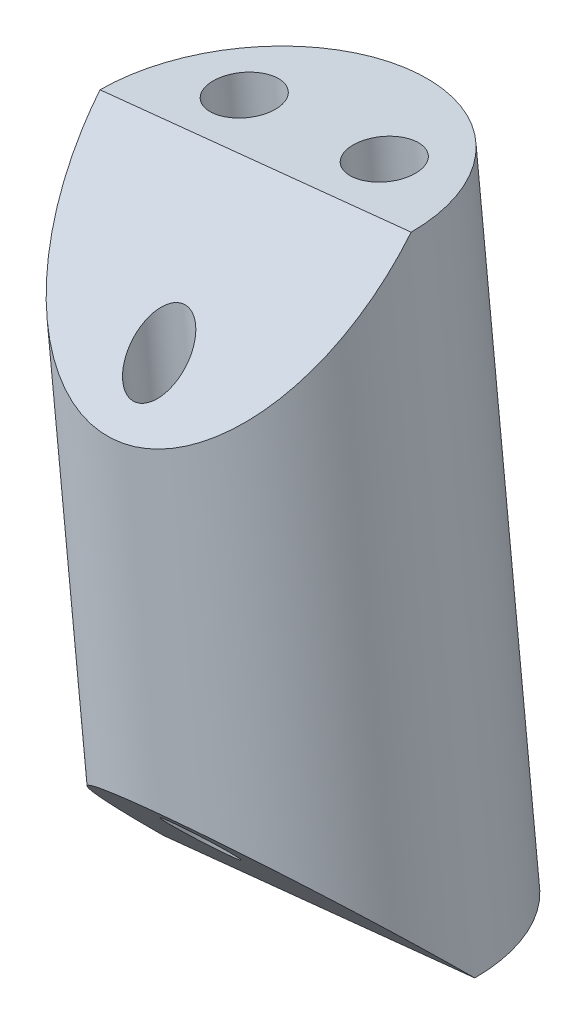
from build123d import *

# Parameters (mm, degrees)
SKETCH3_R               = 8
BOSS_EXTRUDE1_DEPTH     = 31.578947368
CUT_EXTRUDE1_DEPTH      = 200.187264303
CUT_EXTRUDE1_DEPTH_BACK = 200.187264303
CUT_EXTRUDE3_DEPTH      = 39.743711945
CUT_EXTRUDE3_DEPTH_BACK = 39.743711945
SKETCH8_R               = 1.4
SKETCH8_R_2             = 1.6


with BuildPart() as part:
    # Sketch3 → Boss-Extrude1 (new body)
    with BuildSketch(Plane(origin=(-20.344467381, 196.178792599, 0), x_dir=(-0.9946657577296572, -0.10315052302381678, 0), z_dir=(0.10315052302381678, -0.9946657577296572, 0))):
        with Locations((-10.431405186, 0)):
            Circle(SKETCH3_R)
    extrude(amount=BOSS_EXTRUDE1_DEPTH)

    # Sketch4 → Cut-Extrude1 (cut, two sides: drawn at the far end of the back side and taken through both)
    with BuildSketch(Plane(origin=(10.375761543, 1.076004901, 0), x_dir=(0.10315052302381672, -0.9946657577296572, 0), z_dir=(-0.9946657577296572, -0.10315052302381673, 0)).offset(-CUT_EXTRUDE1_DEPTH_BACK)):
        Polygon((-197.230869842, 0), (-189.230869842, 8), (-197.230869842, 8), align=None)
        Polygon((-173.651922474, 8), (-165.651922474, 8), (-165.651922474, 0), align=None)
    extrude(amount=CUT_EXTRUDE1_DEPTH + CUT_EXTRUDE1_DEPTH_BACK, mode=Mode.SUBTRACT)

    # Sketch8 → Cut-Extrude3 (cut, two sides: drawn at the far end of the back side and taken through both)
    with BuildSketch(Plane(origin=(-20.344467381, 196.178792599, 0), x_dir=(0.9946657577296572, 0.10315052302381678, 0), z_dir=(-0.10315052302381678, 0.9946657577296572, 0)).offset(-CUT_EXTRUDE3_DEPTH_BACK)):
        with Locations((10.431405186, -5.5)):
            Circle(SKETCH8_R)
        with Locations((6.831405186, 3)):
            Circle(SKETCH8_R_2)
        with Locations((14.031405186, 3)):
            Circle(SKETCH8_R_2)
    extrude(amount=CUT_EXTRUDE3_DEPTH + CUT_EXTRUDE3_DEPTH_BACK, mode=Mode.SUBTRACT)


solid = part.part
